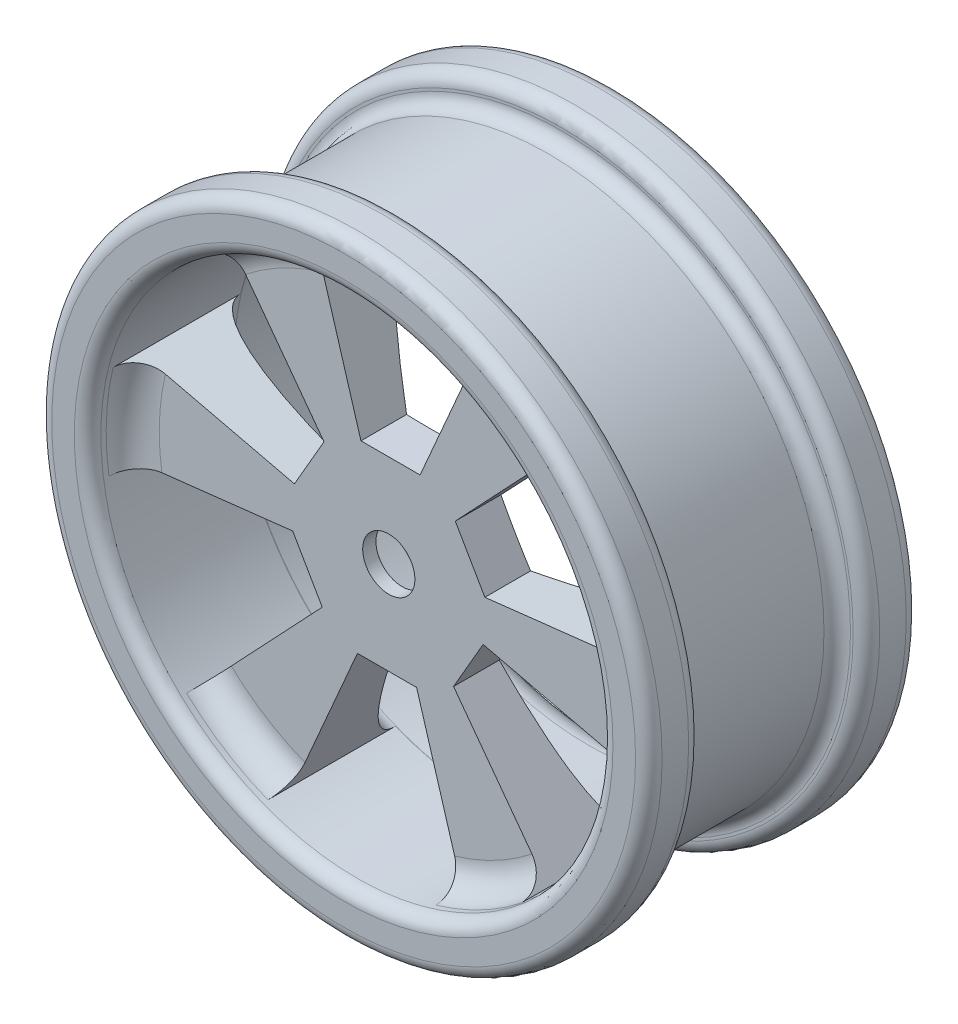
from build123d import *

# Parameters (mm, degrees)
NUT_DEPTH         = 2.54
NUT_DEPTH_BACK    = 8.89
SPOKES_DEPTH      = 45.97306533739945
CIRPATTERN1_COUNT = 6
AXLE_DEPTH        = 45.97306533739945
AXLE_DEPTH_BACK   = 45.97306533739945
SKETCH2_4_R       = 2.500000000000001


with BuildPart() as part:
    # Sketch1 → Body (revolve)
    with BuildSketch(Plane(origin=(0, 0, 0), x_dir=(0, 0, -1), z_dir=(1, 0, 0))):
        with BuildLine():
            Line((17.779999999999998, 27.051), (17.779999999999994, 27.93999999999999))
            ThreePointArc((17.779999999999994, 27.93999999999999), (17.408025612106908, 28.838025612106915), (16.509999999999984, 29.209999999999997))
            Line((16.509999999999984, 29.209999999999997), (13.97, 29.209999999999994))
            ThreePointArc((13.97, 29.209999999999994), (13.071974387893079, 28.83802561210691), (12.699999999999992, 27.939999999999987))
            Line((12.699999999999992, 27.939999999999987), (12.699999999999996, 27.685999999999993))
            ThreePointArc((12.699999999999996, 27.685999999999993), (12.328025612106911, 26.78797438789308), (11.429999999999996, 26.415999999999993))
            Line((11.429999999999996, 26.415999999999993), (-1.7780000000000018, 26.41599999999999))
            ThreePointArc((-1.7780000000000018, 26.41599999999999), (-2.6760256121069173, 26.787974387893076), (-3.048000000000002, 27.685999999999993))
            Line((-3.048000000000002, 27.685999999999993), (-3.048000000000007, 27.939999999999987))
            ThreePointArc((-3.048000000000007, 27.939999999999987), (-3.4199743878930917, 28.83802561210691), (-4.3180000000000165, 29.209999999999997))
            Line((-4.3180000000000165, 29.209999999999997), (-6.857999999999998, 29.209999999999997))
            ThreePointArc((-6.857999999999998, 29.209999999999997), (-7.756025612106923, 28.83802561210691), (-8.128000000000007, 27.939999999999987))
            Line((-8.128000000000007, 27.939999999999987), (-8.128000000000004, 25.781))
            ThreePointArc((-8.128000000000004, 25.781), (-7.756025612106917, 24.882974387893082), (-6.858000000000002, 24.511))
            Line((-6.858000000000002, 24.511), (-6.350000000000001, 24.511))
            ThreePointArc((-6.350000000000001, 24.511), (-4.553948775786168, 23.76705122421383), (-3.8100000000000005, 21.970999999999997))
            Line((-3.8100000000000005, 21.970999999999997), (-3.8099999999999974, 0))
            Line((-3.8099999999999974, 0), (0, 0))
            add(Edge.make_bspline(
                [(5.901255646282522, 24.511), (1.3033659633487824, 24.57380673530667), (0.1121777811443422, 6.630723574277667), (0, 0)],
                knots=[0, 0, 0, 0, 0.9429725869145967, 0.9429725869145967, 0.9429725869145967, 0.9429725869145967], degree=3))
            Line((5.901255646282522, 24.511), (15.239999999999997, 24.511))
            ThreePointArc((15.239999999999997, 24.511), (17.03605122421383, 25.25494877578617), (17.779999999999998, 27.051))
        make_face()
    revolve(axis=Axis((0, 0, 0), (0, 0, -1)))

    # Sketch2 → Nut (cut, two sides: drawn at the far end of the back side and taken through both)
    with BuildSketch(Plane.XY.offset(-NUT_DEPTH_BACK)):
        Polygon((3.4969678192939, -6.444730359305673), (7.329784121346475, -0.19390221192764664), (3.832816302052573, 6.250828147378027), (-3.4969678192939, 6.444730359305676), (-7.329784121346475, 0.19390221192764812), (-3.832816302052575, -6.250828147378025), align=None)
    extrude(amount=NUT_DEPTH + NUT_DEPTH_BACK, mode=Mode.SUBTRACT)

    # Sketch2<3> → Spokes (cut, symmetric)
    with BuildSketch(Plane.XY):
        with BuildLine():
            Line((-2.6636266364536154, 8.889999999999999), (2.9969002544611247, 8.889999999999999))
            Line((2.9969002544611247, 8.889999999999999), (9.031528741506861, 22.786412828511107))
            ThreePointArc((9.031528741506861, 22.786412828511107), (1.0567376722486235, 24.488209948709002), (-7.0350097210490405, 23.479730816701146))
            Line((-7.0350097210490405, 23.479730816701146), (-2.6636266364536154, 8.889999999999999))
        make_face()
    spokes = extrude(amount=SPOKES_DEPTH, both=True, mode=Mode.SUBTRACT)

    # CirPattern1: Spokes ×6 about axis
    cirpattern1_axis = Axis((0, 0, 0), (0, 0, 1))
    for i in range(1, CIRPATTERN1_COUNT):
        add(spokes.rotate(cirpattern1_axis, i * 360 / CIRPATTERN1_COUNT), mode=Mode.SUBTRACT)

    # Sketch2<4> → Axle (cut, two sides: drawn at the far end of the back side and taken through both)
    with BuildSketch(Plane.XY.offset(-AXLE_DEPTH_BACK)):
        Circle(SKETCH2_4_R)
    extrude(amount=AXLE_DEPTH + AXLE_DEPTH_BACK, mode=Mode.SUBTRACT)


solid = part.part
